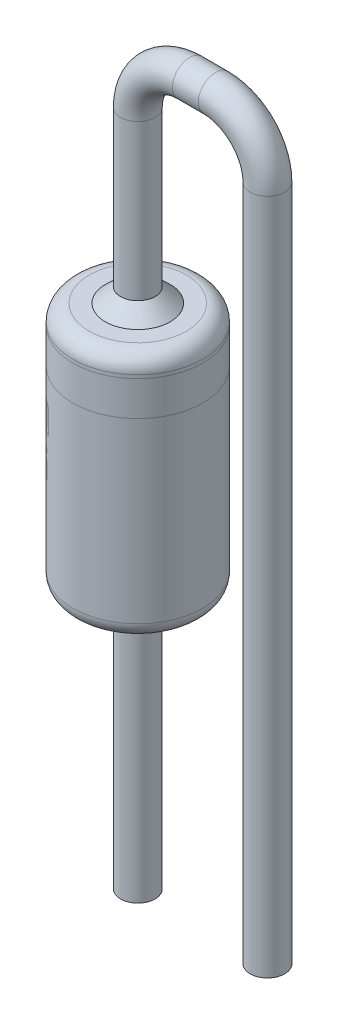
from build123d import *

# Parameters (mm, degrees)
SKETCH6_R = 0.254


with BuildPart() as part:
    # Sketch10 → BODY_main (revolve)
    with BuildSketch(Plane.XY):
        with BuildLine():
            Line((-0.714375, 4.855), (-0.47625, 4.855))
            Line((-0.47625, 4.855), (-0.47625, 1.21))
            Line((-0.47625, 1.21), (-0.714375, 1.21))
            ThreePointArc((-0.714375, 1.21), (-0.882754802, 1.279745198), (-0.9525, 1.448125))
            Line((-0.9525, 1.448125), (-0.9525, 4.616875))
            ThreePointArc((-0.9525, 4.616875), (-0.882754802, 4.785254802), (-0.714375, 4.855))
        make_face()
    revolve(axis=Axis((0, 1, 0), (0, 1, 0)))


with BuildPart() as body_2:
    # Sketch11 → BODY_to_PIN (revolve)
    with BuildSketch(Plane.XY):
        Polygon((0, 1.21), (0, 1), (-0.254, 1), (-0.47625, 1.21), align=None)
        Polygon((-0.47625, 4.855), (0, 4.855), (0, 5.065), (-0.254, 5.065), align=None)
    revolve(axis=Axis((0, 1, 0), (0, 1, 0)))


with BuildPart() as body_3:
    # PINS: sweep along a path in Sketch7
    with BuildLine(Plane.XY) as pins_path:
        Line((0, -2.6), (0, 7.345053199))
        ThreePointArc((0, 7.345053199), (0.223184633, 7.883868566), (0.762, 8.107053199))
        Line((0.762, 8.107053199), (1.143, 8.107053199))
        ThreePointArc((1.143, 8.107053199), (1.681815367, 7.883868566), (1.905, 7.345053199))
        Line((1.905, 7.345053199), (1.905, -2.6))
    # Sketch6 → PINS (sweep)
    with BuildSketch(Plane(origin=(1, 1, 0), x_dir=(0, 0, -1), z_dir=(0, 1, 0))):
        with Locations((0, 1)):
            Circle(SKETCH6_R)
    sweep(path=pins_path.line)


solid = Compound([part.part, body_2.part, body_3.part])
